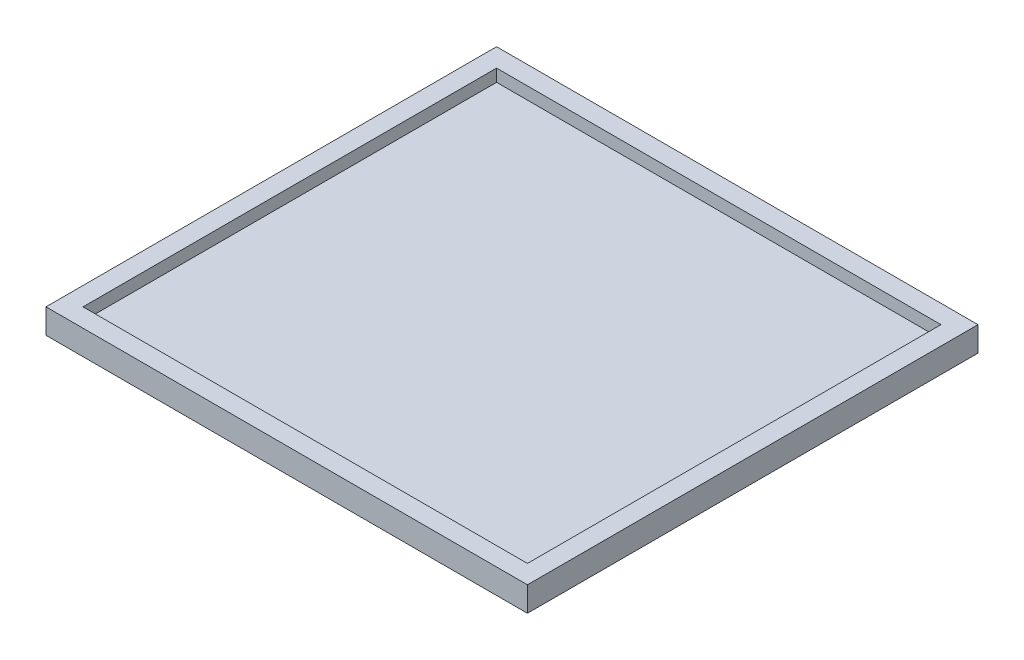
from build123d import *

# Parameters (mm, degrees)
SKETCH2_W           = 78
SKETCH2_H           = 73
BOSS_EXTRUDE1_DEPTH = 4
SKETCH3_W           = 72
SKETCH3_H           = 67
CUT_EXTRUDE1_DEPTH  = 2


with BuildPart() as part:
    # Sketch2 → Boss-Extrude1 (new body)
    with BuildSketch(Plane(origin=(0, 0, 0), x_dir=(1, 0, 0), z_dir=(0, 1, 0))):
        with Locations((39, 36.5)):
            Rectangle(SKETCH2_W, SKETCH2_H)
    extrude(amount=BOSS_EXTRUDE1_DEPTH)

    # Sketch3 → Cut-Extrude1 (cut)
    with BuildSketch(Plane(origin=(0, 4, 0), x_dir=(1, 0, 0), z_dir=(0, 1, 0))):
        with Locations((39, 36.5)):
            Rectangle(SKETCH3_W, SKETCH3_H)
    extrude(amount=-CUT_EXTRUDE1_DEPTH, mode=Mode.SUBTRACT)


solid = part.part
